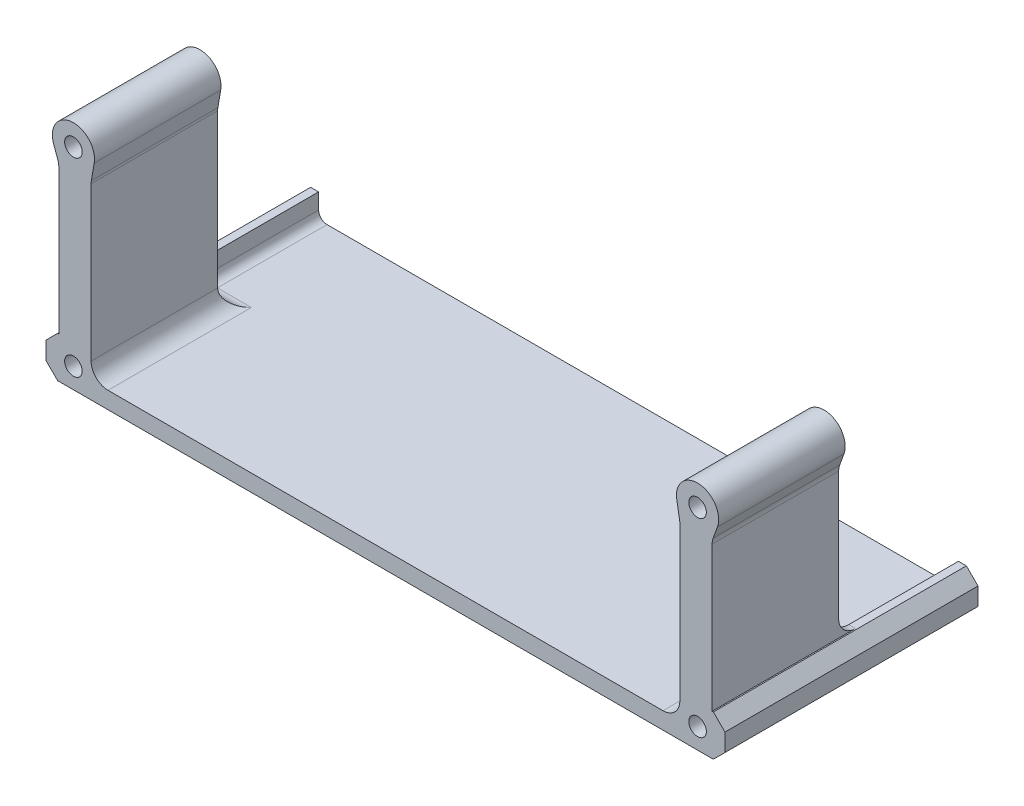
from build123d import *

# Parameters (mm, degrees)
BOSS_EXTRUDE1_DEPTH      = 101.6
SKETCH3_W                = 19.05
SKETCH3_H                = 15.24
BOSS_EXTRUDE3_DEPTH      = 2.54
BOSS_EXTRUDE4_DEPTH      = 3.175
SKETCH5_R                = 3.96875
CUT_EXTRUDE1_DEPTH       = 113.522583006
SKETCH18_W               = 3.847197439
SKETCH18_H               = 19.05
BOSS_EXTRUDE9_DEPTH      = 3.630394878
BOSS_EXTRUDE17_DEPTH     = 19.05
SKETCH20_R               = 1.3208
CUT_EXTRUDE7_DEPTH       = 7.62
FILLET3_R                = 2.54
FILLET4_R                = 2.54
CUT_EXTRUDE19_DEPTH      = 119.165702994
FILLET12_R               = 0.508
FILLET24_R               = 1.27
CUT_EXTRUDE20_DEPTH      = 119.230869843
CUT_EXTRUDE20_DEPTH_BACK = 119.230869843
SKETCH41_W               = 159.957489038
SKETCH41_H               = 86.494386596


with BuildPart() as part:
    # Sketch1 → Boss-Extrude1 (new body)
    with BuildSketch(Plane.XY):
        Polygon((-49.440197439, 3.085197439), (-51.308, 1.217394878), (-51.308, -1.217394878), (-49.440197439, -3.085197439), (49.440197439, -3.085197439), (51.308, -1.217394878), (51.308, 1.217394878), (49.440197439, 3.085197439), (48.170197439, 3.085197439), (48.170197439, -0.545197439), (-48.170197439, -0.545197439), (-48.170197439, 3.085197439), align=None)
    extrude(amount=-BOSS_EXTRUDE1_DEPTH)

    # Sketch3 → Boss-Extrude3 (add)
    with BuildSketch(Plane(origin=(0, 0, -101.6), x_dir=(-1, 0, 0), z_dir=(0, 0, -1))):
        with Locations((38.645197439, 7.074802561)):
            Rectangle(SKETCH3_W, SKETCH3_H)
    extrude(amount=-BOSS_EXTRUDE3_DEPTH)

    # Sketch4 → Boss-Extrude4 (add)
    with BuildSketch(Plane(origin=(-29.120197439, 0, 0), x_dir=(0, 0, -1), z_dir=(1, 0, 0))):
        Polygon((99.06, 14.694802561), (83.82, -0.545197439), (99.06, -0.545197439), align=None)
    boss_extrude4 = extrude(amount=-BOSS_EXTRUDE4_DEPTH)

    # Mirror1: Boss-Extrude4 across plane
    add(boss_extrude4.mirror(Plane(origin=(-38.645197439, 0, 0), x_dir=(0, 0, 1), z_dir=(1, 0, 0))))

    # Sketch5 → Cut-Extrude1 (cut, through all)
    with BuildSketch(Plane.XY.offset(-99.06)):
        with Locations((-38.6334, 6.985)):
            Circle(SKETCH5_R)
    extrude(amount=-CUT_EXTRUDE1_DEPTH, mode=Mode.SUBTRACT)

    # Sketch18 → Boss-Extrude9 (add)
    with BuildSketch(Plane(origin=(0, 3.085197439, 0), x_dir=(1, 0, 0), z_dir=(0, 1, 0))):
        with Locations((46.246598719, 9.525)):
            Rectangle(SKETCH18_W, SKETCH18_H)
        with Locations((-46.246598719, 9.525)):
            Rectangle(SKETCH18_W, SKETCH18_H)
    extrude(amount=-BOSS_EXTRUDE9_DEPTH)

    # Sketch39 → Boss-Extrude17 (add)
    with BuildSketch(Plane.XY):
        with BuildLine():
            Line((49.186197439, 3.085197439), (44.323, 3.085197439))
            Line((44.323, 3.085197439), (44.323, 25.325923901))
            Line((44.323, 25.325923901), (43.86013816, 28.041530355))
            ThreePointArc((43.86013816, 28.041530355), (47.275748779, 31.737115215), (49.973524071, 27.489086045))
            Line((49.973524071, 27.489086045), (49.186197439, 25.325923901))
            Line((49.186197439, 25.325923901), (49.186197439, 3.085197439))
        make_face()
    boss_extrude17 = extrude(amount=-BOSS_EXTRUDE17_DEPTH)

    # Mirror5: Boss-Extrude17 across plane
    add(boss_extrude17.mirror(Plane(origin=(0, 0, 0), x_dir=(0, 0, 1), z_dir=(1, 0, 0))))

    # Sketch20 → Cut-Extrude7 (cut)
    with BuildSketch(Plane.XY):
        with Locations((46.99, 0)):
            Circle(SKETCH20_R)
        with Locations((-46.99, 0)):
            Circle(SKETCH20_R)
        with Locations((-46.99, 28.575)):
            Circle(SKETCH20_R)
        with Locations((46.99, 28.575)):
            Circle(SKETCH20_R)
    extrude(amount=-CUT_EXTRUDE7_DEPTH, mode=Mode.SUBTRACT)

    # Fillet3
    fillet3_edges = [part.edges().sort_by_distance(p)[0] for p in [
        (44.323, 25.325923901, -9.525),
        (49.186197439, 25.325923901, -9.525),
        (-49.186197439, 25.325923901, -9.525),
        (-44.323, 25.325923901, -9.525),
    ]]
    fillet(fillet3_edges, radius=FILLET3_R)

    # Fillet4
    fillet4_edges = [part.edges().sort_by_distance(p)[0] for p in [
        (48.678197439, 3.085197439, -19.05),
        (-48.678197439, 3.085197439, -19.05),
        (44.323, -0.545197439, -9.525),
        (46.246598719, -0.545197439, -19.05),
        (-46.246598719, -0.545197439, -19.05),
        (-44.323, -0.545197439, -9.525),
    ]]
    fillet(fillet4_edges, radius=FILLET4_R)

    # Sketch40 → Cut-Extrude19 (cut, through all)
    with BuildSketch(Plane.XY):
        Polygon((-49.36835539, 3.085197439), (-51.1175, 1.336052829), (-51.1175, -1.336052829), (-49.36835539, -3.085197439), (-52.3875, -3.085197439), (-52.3875, 3.085197439), align=None)
        Polygon((52.3875, 3.085197439), (52.3875, -3.085197439), (49.36835539, -3.085197439), (51.1175, -1.336052829), (51.1175, 1.336052829), (49.36835539, 3.085197439), align=None)
    extrude(amount=-CUT_EXTRUDE19_DEPTH, mode=Mode.SUBTRACT)

    # Fillet12
    # the kernel refuses this fillet: 0.508 mm, written as the material it adds along each edge
    with BuildSketch(Plane(origin=(-48.170197439, 3.085197439, -86.180394878), x_dir=(-1, 0, 0), z_dir=(0, 0, -1))) as fillet12_piece_1_section:
        with BuildLine():
            CenterArc((FILLET12_R, FILLET12_R), FILLET12_R, 180, 90)
            Line((0, FILLET12_R), (0, 0))
            Line((0, 0), (FILLET12_R, 0))
        make_face()
    fillet12_piece_1 = extrude(amount=15.419605122, mode=Mode.PRIVATE)
    fillet12_piece_1 = split(fillet12_piece_1, bisect_by=Plane(origin=(-48.284048629, 6.707217092, -91.072414531), z_dir=(0, -0.7071067811865475, -0.7071067811865476)), keep=Keep.TOP, mode=Mode.PRIVATE)
    add(fillet12_piece_1)

    # Fillet24
    fillet24_edges = [part.edges().sort_by_distance(p)[0] for p in [
        (-48.170197439, 3.81, -19.05),
        (-48.170197439, 0.198751337, -19.793948776),
        (-48.170197439, -0.545197439, -52.705),
    ]]
    fillet(fillet24_edges, radius=FILLET24_R)

    # Sketch41 → Cut-Extrude20 (cut, two sides: drawn at the far end of the back side and taken through both)
    with BuildSketch(Plane(origin=(0, -0.545197439, 0), x_dir=(1, 0, 0), z_dir=(0, 1, 0)).offset(-CUT_EXTRUDE20_DEPTH_BACK)):
        with Locations((1.60361347, 81.347193298)):
            Rectangle(SKETCH41_W, SKETCH41_H)
    extrude(amount=CUT_EXTRUDE20_DEPTH + CUT_EXTRUDE20_DEPTH_BACK, mode=Mode.SUBTRACT)


solid = part.part
